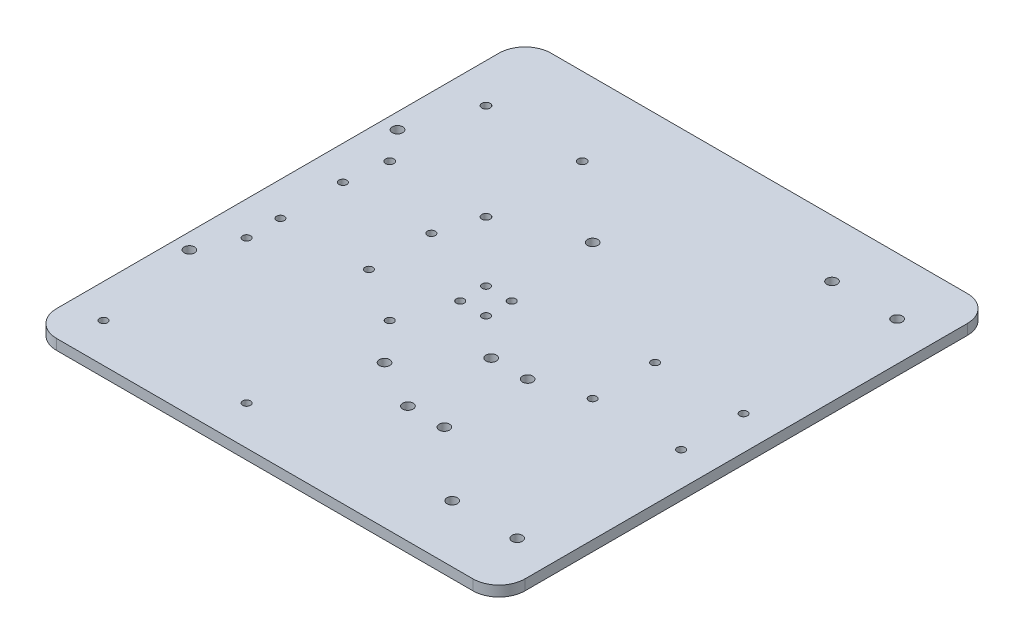
from build123d import *

# Parameters (mm, degrees)
SKETCH_1_W           = 180
SKETCH_1_H           = 190
EXTRUDE_1_DEPTH      = 4
SKETCH_4_R           = 1.6
CUT_EXTRUDE_3_DEPTH  = 4
SKETCH_5_R           = 1.5
CUT_EXTRUDE_4_DEPTH  = 4
SKETCH_7_R           = 2
CUT_EXTRUDE_5_DEPTH  = 10
SKETCH_8_R           = 1.5
CUT_EXTRUDE_6_DEPTH  = 10
SKETCH_11_R          = 1.5
CUT_EXTRUDE_8_DEPTH  = 4
SKETCH_12_R          = 2
CUT_EXTRUDE_9_DEPTH  = 4
SKETCH_15_R          = 2
CUT_EXTRUDE_10_DEPTH = 131.923641868
FILLET_2_R           = 10


with BuildPart() as part:
    # 草图1 → 凸台-拉伸1 (new body)
    with BuildSketch(Plane(origin=(0, 0, 0), x_dir=(1, 0, 0), z_dir=(0, 1, 0))):
        Rectangle(SKETCH_1_W, SKETCH_1_H)
    extrude(amount=EXTRUDE_1_DEPTH)

    # 草图4 → 切除-拉伸3 (cut)
    with BuildSketch(Plane(origin=(0, 4, 0), x_dir=(1, 0, 0), z_dir=(0, 1, 0))):
        with Locations((-75, 65)):
            Circle(SKETCH_4_R)
        with Locations((-38, 65)):
            Circle(SKETCH_4_R)
        with Locations((-38, 28)):
            Circle(SKETCH_4_R)
        with Locations((-75, 28)):
            Circle(SKETCH_4_R)
    extrude(amount=-CUT_EXTRUDE_3_DEPTH, mode=Mode.SUBTRACT)

    # 草图5 → 切除-拉伸4 (cut)
    with BuildSketch(Plane(origin=(0, 4, 0), x_dir=(1, 0, 0), z_dir=(0, 1, 0))):
        with Locations((-77, -80)):
            Circle(SKETCH_5_R)
        with Locations((-77, -25)):
            Circle(SKETCH_5_R)
        with Locations((-22, -25)):
            Circle(SKETCH_5_R)
        with Locations((-22, -80)):
            Circle(SKETCH_5_R)
    extrude(amount=-CUT_EXTRUDE_4_DEPTH, mode=Mode.SUBTRACT)

    # 草图7 → 切除-拉伸5 (cut)
    with BuildSketch(Plane.XZ):
        with Locations((24, 50)):
            Circle(SKETCH_7_R)
        with Locations((10, 50)):
            Circle(SKETCH_7_R)
        with Locations((24, 18)):
            Circle(SKETCH_7_R)
        with Locations((10, 18)):
            Circle(SKETCH_7_R)
    extrude(amount=-CUT_EXTRUDE_5_DEPTH, mode=Mode.SUBTRACT)

    # 草图8 → 切除-拉伸6 (cut)
    with BuildSketch(Plane.XZ):
        with Locations((-14.949747468, 4.949747468)):
            Circle(SKETCH_8_R)
        with Locations((-5.050252532, 4.949747468)):
            Circle(SKETCH_8_R)
        with Locations((-14.949747468, -4.949747468)):
            Circle(SKETCH_8_R)
        with Locations((-5.050252532, -4.949747468)):
            Circle(SKETCH_8_R)
    extrude(amount=-CUT_EXTRUDE_6_DEPTH, mode=Mode.SUBTRACT)

    # 草图11 → 切除-拉伸8 (cut)
    with BuildSketch(Plane.XZ):
        with Locations((77, 12)):
            Circle(SKETCH_11_R)
        with Locations((43, 12)):
            Circle(SKETCH_11_R)
        with Locations((77, -12)):
            Circle(SKETCH_11_R)
        with Locations((43, -12)):
            Circle(SKETCH_11_R)
    cut_extrude_8 = extrude(amount=-CUT_EXTRUDE_8_DEPTH, mode=Mode.SUBTRACT)

    # 草图12 → 切除-拉伸9 (cut)
    with BuildSketch(Plane.XZ):
        with Locations((-84, 40)):
            Circle(SKETCH_12_R)
        with Locations((-9, 40)):
            Circle(SKETCH_12_R)
        with Locations((-9, -40)):
            Circle(SKETCH_12_R)
        with Locations((-84, -40)):
            Circle(SKETCH_12_R)
    extrude(amount=-CUT_EXTRUDE_9_DEPTH, mode=Mode.SUBTRACT)

    # 草图15 → 切除-拉伸10 (cut, through all)
    with BuildSketch(Plane(origin=(0, 4, 0), x_dir=(1, 0, 0), z_dir=(0, 1, 0))):
        with Locations((75, -73)):
            Circle(SKETCH_15_R)
        with Locations((50, -73)):
            Circle(SKETCH_15_R)
    cut_extrude_10 = extrude(amount=-CUT_EXTRUDE_10_DEPTH, mode=Mode.SUBTRACT)

    # 镜向2: 切除-拉伸10 across plane
    add(cut_extrude_10.mirror(Plane.XY), mode=Mode.SUBTRACT)

    # 圆角2
    fillet_2_edges = [part.edges().sort_by_distance(p)[0] for p in [
        (-90, 2, 95),
        (90, 2, 95),
        (90, 2, -95),
        (-90, 2, -95),
    ]]
    fillet(fillet_2_edges, radius=FILLET_2_R)

    # 镜向3: 切除-拉伸8 across plane
    add(cut_extrude_8.mirror(Plane(origin=(0, 0, 0), x_dir=(0, 0, 1), z_dir=(1, 0, 0))), mode=Mode.SUBTRACT)


solid = part.part
